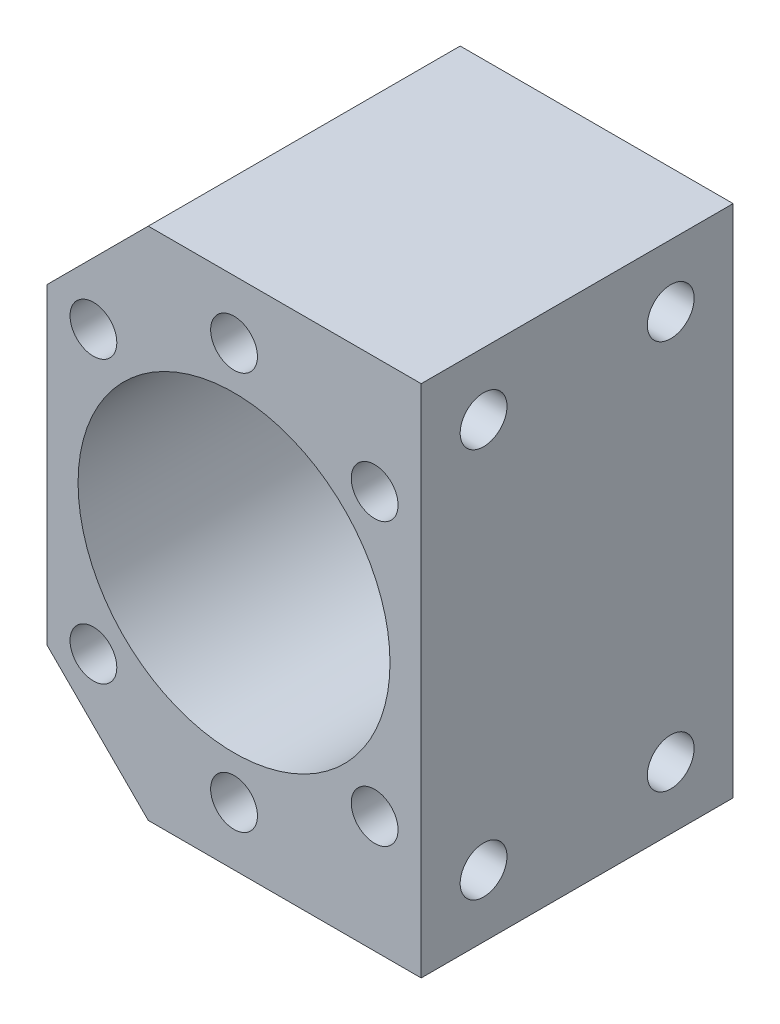
from build123d import *

# Parameters (mm, degrees)
SKETCH1_R           = 20
BOSS_EXTRUDE2_DEPTH = 40
SKETCH8_R           = 3
CUT_EXTRUDE1_DEPTH  = 16
SKETCH9_R           = 3
CUT_EXTRUDE2_DEPTH  = 16


with BuildPart() as part:
    # Sketch1 → Boss-Extrude2 (new body)
    with BuildSketch(Plane.XY):
        Polygon((-24, -20), (-11, -33), (24, -33), (24, 33), (-11, 33), (-24, 20), align=None)
        Circle(SKETCH1_R, mode=Mode.SUBTRACT)
    extrude(amount=BOSS_EXTRUDE2_DEPTH)

    # Sketch8 → Cut-Extrude1 (cut)
    with BuildSketch(Plane.XY.offset(40)):
        with Locations((0, 25.5)):
            Circle(SKETCH8_R)
        with Locations((18.03122292, 18.03122292)):
            Circle(SKETCH8_R)
        with Locations((18.03122292, -18.03122292)):
            Circle(SKETCH8_R)
        with Locations((0, -25.5)):
            Circle(SKETCH8_R)
        with Locations((-18.03122292, -18.03122292)):
            Circle(SKETCH8_R)
        with Locations((-18.03122292, 18.03122292)):
            Circle(SKETCH8_R)
    extrude(amount=-CUT_EXTRUDE1_DEPTH, mode=Mode.SUBTRACT)

    # Sketch9 → Cut-Extrude2 (cut)
    with BuildSketch(Plane(origin=(24, 0, 0), x_dir=(0, 0, -1), z_dir=(1, 0, 0))):
        with Locations((-32, 25)):
            Circle(SKETCH9_R)
        with Locations((-8, 25)):
            Circle(SKETCH9_R)
        with Locations((-8, -25)):
            Circle(SKETCH9_R)
        with Locations((-32, -25)):
            Circle(SKETCH9_R)
    extrude(amount=-CUT_EXTRUDE2_DEPTH, mode=Mode.SUBTRACT)


solid = part.part
